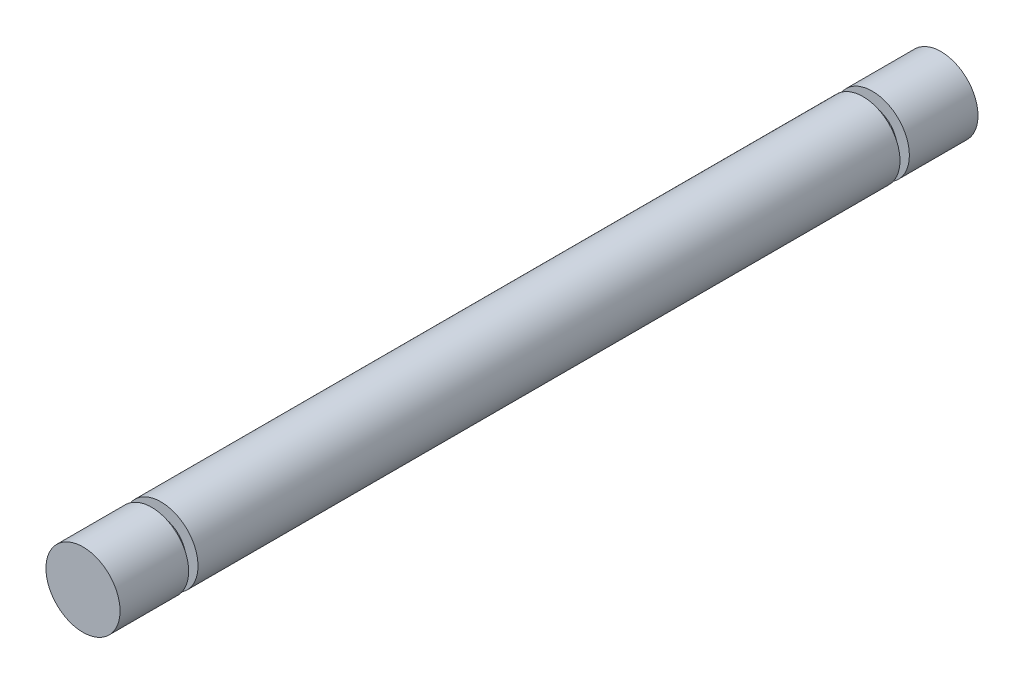
from build123d import *

# Parameters (mm, degrees)
SKETCH1_R           = 2.375
BOSS_EXTRUDE1_DEPTH = 22.5
SKETCH2_R           = 1.6
BOSS_EXTRUDE2_DEPTH = 0.6
SKETCH3_R           = 2.375
BOSS_EXTRUDE3_DEPTH = 4.4


with BuildPart() as part:
    # Sketch1 → Boss-Extrude1 (new body)
    with BuildSketch(Plane.XY):
        Circle(SKETCH1_R)
    boss_extrude1 = extrude(amount=BOSS_EXTRUDE1_DEPTH)

    # Sketch2 → Boss-Extrude2 (add)
    with BuildSketch(Plane.XY.offset(22.5)):
        Circle(SKETCH2_R)
    boss_extrude2 = extrude(amount=BOSS_EXTRUDE2_DEPTH)

    # Sketch3 → Boss-Extrude3 (add)
    with BuildSketch(Plane.XY.offset(23.1)):
        Circle(SKETCH3_R)
    boss_extrude3 = extrude(amount=BOSS_EXTRUDE3_DEPTH)

    # Mirror1: Boss-Extrude1, Boss-Extrude2, Boss-Extrude3 across plane
    add(boss_extrude1.mirror(Plane.XY))
    add(boss_extrude2.mirror(Plane.XY))
    add(boss_extrude3.mirror(Plane.XY))


solid = part.part
